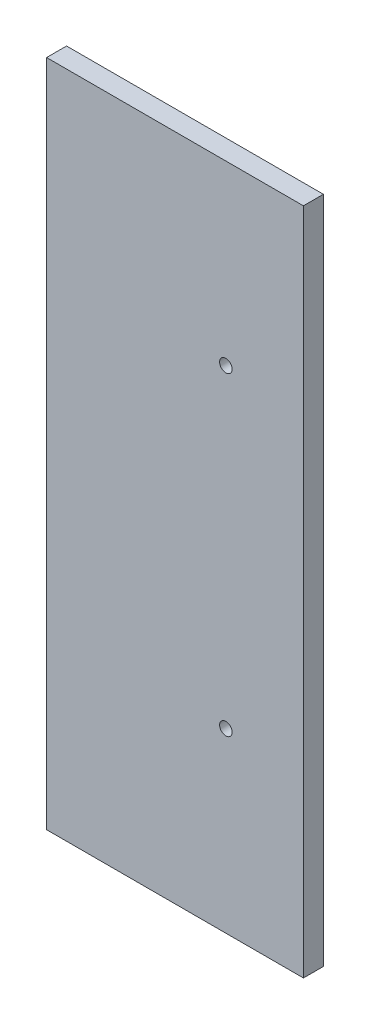
from build123d import *

# Parameters (mm, degrees)
SKETCH1_W                  = 245.05
SKETCH1_H                  = 638.1
BOSS_EXTRUDE1_DEPTH        = 19.05
F_12_0MM_DOWEL_HOLE1_D     = 12
F_12_0MM_DOWEL_HOLE1_DEPTH = 26.394836286
F_12_0MM_DOWEL_HOLE1_TIP   = 3.605163714


with BuildPart() as part:
    # Sketch1 → Boss-Extrude1 (new body)
    with BuildSketch(Plane.XY):
        with Locations((-122.525, -319.05)):
            Rectangle(SKETCH1_W, SKETCH1_H)
    extrude(amount=BOSS_EXTRUDE1_DEPTH)

    # Ø12.0mm Dowel Hole1
    with Locations(Plane(origin=(0, 0, 0), x_dir=(-1, 0, 0), z_dir=(0, 0, -1))):
        with Locations((74, -469.05), (74, -169.05)):
            Hole(F_12_0MM_DOWEL_HOLE1_D / 2, depth=F_12_0MM_DOWEL_HOLE1_DEPTH)
            with Locations((0, 0, -(F_12_0MM_DOWEL_HOLE1_DEPTH + F_12_0MM_DOWEL_HOLE1_TIP / 2))):  # 118° drill point
                Cone(0, F_12_0MM_DOWEL_HOLE1_D / 2, F_12_0MM_DOWEL_HOLE1_TIP, mode=Mode.SUBTRACT)


solid = part.part
